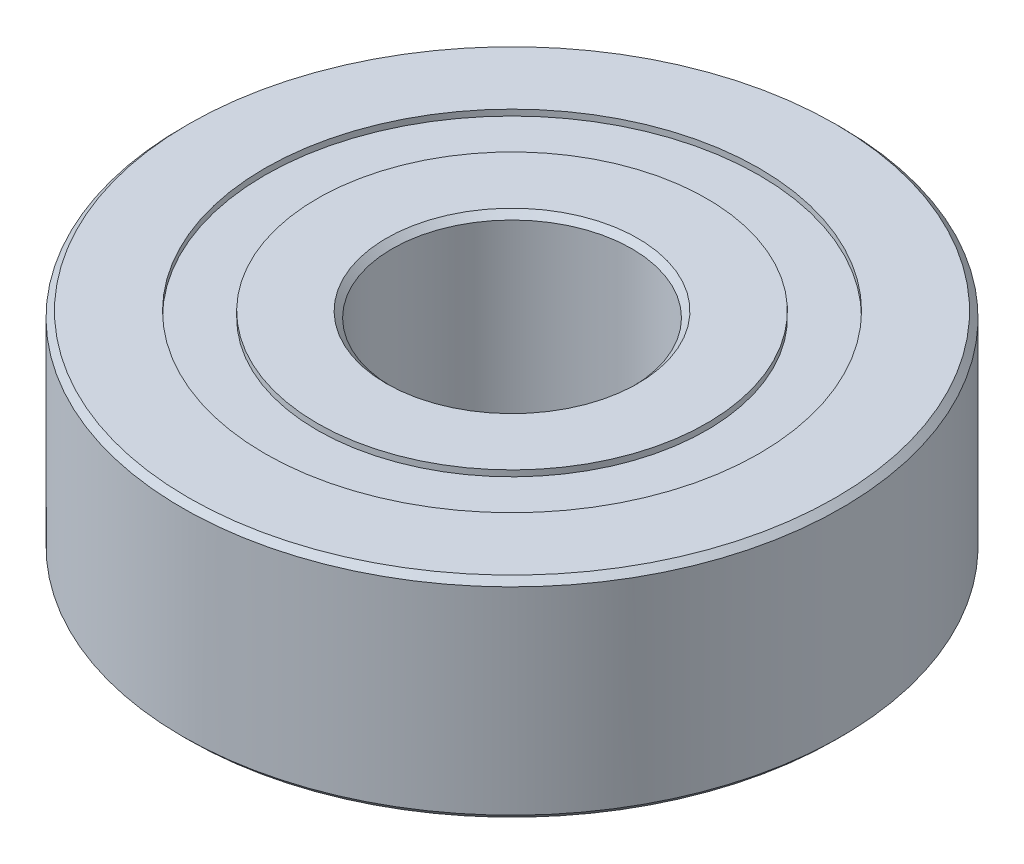
from build123d import *

# Parameters (mm, degrees)
SKETCH1_R           = 11
SKETCH1_R_2         = 4
BOSS_EXTRUDE1_DEPTH = 7
SKETCH2_R           = 8.25
SKETCH2_R_2         = 6.5
CUT_EXTRUDE1_DEPTH  = 0.2
CUT_EXTRUDE2_START  = -0.2
SKETCH3_R           = 8.25
SKETCH3_R_2         = 6.5
CUT_EXTRUDE2_DEPTH  = 0.2
CHAMFER1_SIZE       = 0.2


with BuildPart() as part:
    # Sketch1 → Boss-Extrude1 (new body)
    with BuildSketch(Plane(origin=(0, 0, 0), x_dir=(1, 0, 0), z_dir=(0, 1, 0))):
        Circle(SKETCH1_R)
        Circle(SKETCH1_R_2, mode=Mode.SUBTRACT)
    extrude(amount=BOSS_EXTRUDE1_DEPTH)

    # Sketch2 → Cut-Extrude1 (cut)
    with BuildSketch(Plane(origin=(0, 7, 0), x_dir=(1, 0, 0), z_dir=(0, 1, 0))):
        Circle(SKETCH2_R)
        Circle(SKETCH2_R_2, mode=Mode.SUBTRACT)
    extrude(amount=-CUT_EXTRUDE1_DEPTH, mode=Mode.SUBTRACT)

    # Sketch3 → Cut-Extrude2 (cut)
    with BuildSketch(Plane.XZ.offset(CUT_EXTRUDE2_START)):
        Circle(SKETCH3_R)
        Circle(SKETCH3_R_2, mode=Mode.SUBTRACT)
    extrude(amount=CUT_EXTRUDE2_DEPTH, mode=Mode.SUBTRACT)

    # Chamfer1
    chamfer1_edges = [part.edges().sort_by_distance(p)[0] for p in [
        (-11, 7, 0),
        (-11, 0, 0),
        (-4, 7, 0),
        (-4, 0, 0),
    ]]
    chamfer(chamfer1_edges, length=CHAMFER1_SIZE)


solid = part.part
